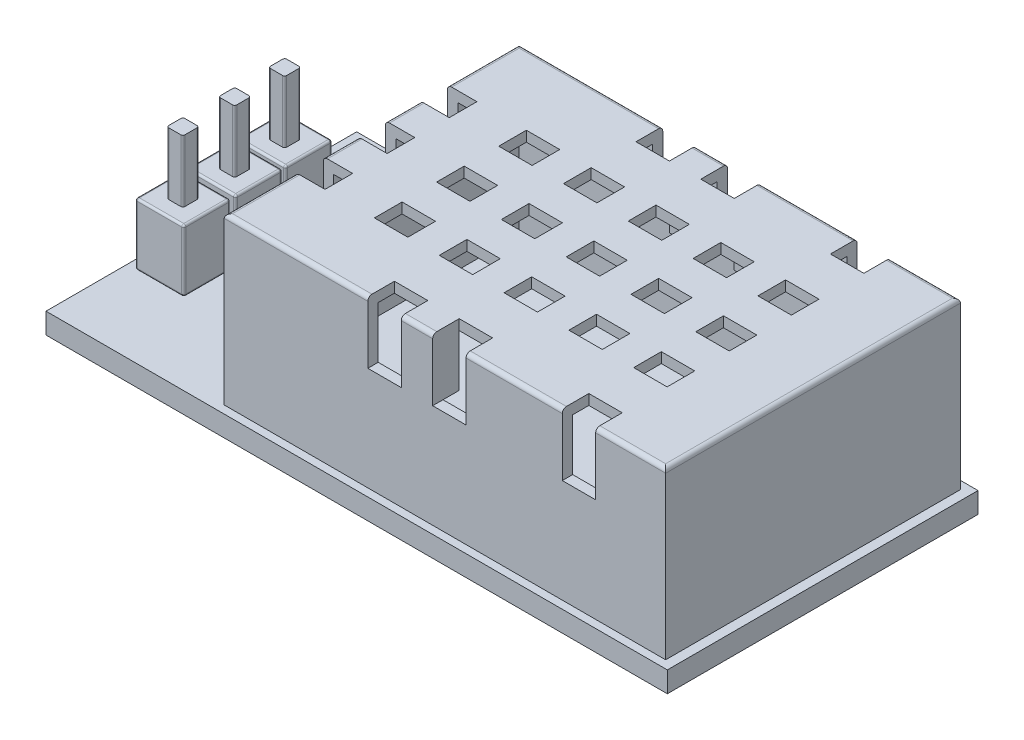
from build123d import *

# Parameters (mm, degrees)
SKETCH_1_W              = 30
SKETCH_1_H              = 15
EXTRUDE_1_DEPTH         = 0.5
SKETCH_2_W              = 21.312258838
SKETCH_2_H              = 14.23879362
EXTRUDE_2_DEPTH         = 8
SKETCH_3_W              = 1.613226707
SKETCH_3_H              = 1.334895255
CUT_EXTRUDE_1_DEPTH     = 3
THICKEN_START           = -7.11939681
THICKEN_1_OUTLINE_W     = 1.516062885
THICKEN_1_OUTLINE_H     = 0.5
THICKEN_1_OUTLINE_W_2   = 1.516062886
THICKEN_1_OUTLINE_W_3   = 2.386773293
THICKEN_1_DEPTH         = 14.23879362
THICKEN_1_2_DEPTH       = 0.5
THICKEN_START_2         = 6.61939681
THICKEN_1_3_DEPTH       = 0.5
THICKEN_START_3         = -5.827698579
THICKEN_1_4_OUTLINE_W   = 1.613226707
THICKEN_1_4_OUTLINE_H   = 0.5
THICKEN_1_4_DEPTH       = 2.165104745
THICKEN_START_4         = 3.672301421
THICKEN_1_5_OUTLINE_W   = 1.613226707
THICKEN_1_5_OUTLINE_H   = 0.5
THICKEN_1_5_DEPTH       = 2.165104745
THICKEN_START_5         = -2.327698579
THICKEN_1_6_OUTLINE_W   = 1.613226707
THICKEN_1_6_OUTLINE_H   = 0.5
THICKEN_1_6_DEPTH       = 1.665104745
THICKEN_START_6         = 0.672301421
THICKEN_1_7_OUTLINE_W   = 1.613226707
THICKEN_1_7_OUTLINE_H   = 0.5
THICKEN_1_7_DEPTH       = 1.665104745
THICKEN_START_7         = -6.61939681
THICKEN_1_8_OUTLINE_W   = 0.5
THICKEN_1_8_OUTLINE_H   = 2.5
THICKEN_1_8_OUTLINE_W_2 = 1.613226707
THICKEN_1_8_OUTLINE_H_2 = 0.5
THICKEN_1_8_DEPTH       = 0.791698231
THICKEN_START_8         = 5.837406166
THICKEN_1_9_OUTLINE_W   = 0.5
THICKEN_1_9_OUTLINE_H   = 2.5
THICKEN_1_9_OUTLINE_W_2 = 1.613226707
THICKEN_1_9_OUTLINE_H_2 = 0.5
THICKEN_1_9_DEPTH       = 0.781990644
FILLET_1_R              = 0.2
SKETCH_4_W              = 2.342511209
SKETCH_4_H              = 2.250648024
EXTRUDE_3_DEPTH         = 3
EXTRUDE_3_2_DEPTH       = 3
SKETCH_4_H_2            = 2.250648023
EXTRUDE_3_3_DEPTH       = 3
SKETCH_5_W              = 0.780837069
SKETCH_5_H              = 0.78083707
EXTRUDE_4_DEPTH         = 3
SKETCH_5_H_2            = 0.780837069
EXTRUDE_4_2_DEPTH       = 3
EXTRUDE_4_3_DEPTH       = 3
FILLET_2_R              = 0.1
FILLET_3_R              = 0.1
FILLET_4_R              = 0.1
FILLET_6_R              = 0.1
FILLET_7_R              = 0.1
FILLET_8_R              = 0.1
SKETCH_6_R              = 1.271442561
CUT_EXTRUDE_2_DEPTH     = 19.580904176


# Read off the part's stored shape, not the designer's step: 두껍게1
with BuildPart() as part:
    # 스케치1 → 보스-돌출1 (new, symmetric)
    with BuildSketch(Plane(origin=(0, 0, 0), x_dir=(1, 0, 0), z_dir=(0, 1, 0))):
        Rectangle(SKETCH_1_W, SKETCH_1_H)
    extrude(amount=EXTRUDE_1_DEPTH, both=True)

    # 두껍게1 outline → 두껍게1 (add)
    with BuildSketch(Plane.XY.offset(THICKEN_START)):
        Polygon((11.160459425, 8.5), (11.160459425, 8), (14.03734897, 8), (14.03734897, 1), (-6.274909868, 1), (-6.274909868, 5.5), (-6.774909868, 5.5), (-6.774909868, 0.5), (14.53734897, 0.5), (14.53734897, 8.5), align=None)
        with Locations((8.789201275, 8.25)):
            Rectangle(THICKEN_1_OUTLINE_W, THICKEN_1_OUTLINE_H)
        with Locations((5.659911683, 8.25)):
            Rectangle(THICKEN_1_OUTLINE_W_2, THICKEN_1_OUTLINE_H)
        with Locations((2.530622091, 8.25)):
            Rectangle(THICKEN_1_OUTLINE_W, THICKEN_1_OUTLINE_H)
        with Locations((-4.163312298, 8.25)):
            Rectangle(THICKEN_1_OUTLINE_W_3, THICKEN_1_OUTLINE_H)
        with Locations((-0.598667502, 8.25)):
            Rectangle(THICKEN_1_OUTLINE_W, THICKEN_1_OUTLINE_H)
    extrude(amount=THICKEN_1_DEPTH)

    # Thicken 1 2 outline → Thicken 1 2 (add)
    with BuildSketch(Plane.XY.offset(THICKEN_START)):
        Polygon((11.160459425, 8), (11.160459425, 5.5), (9.547232718, 5.5), (9.547232718, 8), (8.031169833, 8), (8.031169833, 8.5), (6.417943126, 8.5), (6.417943126, 8), (4.90188024, 8), (4.90188024, 5.5), (3.288653533, 5.5), (3.288653533, 8), (1.772590648, 8), (1.772590648, 5.5), (0.159363941, 5.5), (0.159363941, 8), (-1.356698944, 8), (-1.356698944, 8.5), (-2.969925651, 8.5), (-2.969925651, 8), (-5.356698944, 8), (-5.356698944, 8.5), (-6.774909868, 8.5), (-6.774909868, 5.5), (-6.274909868, 5.5), (-6.274909868, 1), (14.03734897, 1), (14.03734897, 8), align=None)
    extrude(amount=THICKEN_1_2_DEPTH)

    # Thicken 1 3 outline → Thicken 1 3 (add)
    with BuildSketch(Plane.XY.offset(THICKEN_START_2)):
        Polygon((11.160459425, 8), (11.160459425, 5.5), (9.547232718, 5.5), (9.547232718, 8), (8.031169833, 8), (8.031169833, 8.5), (6.417943126, 8.5), (6.417943126, 8), (4.90188024, 8), (4.90188024, 5.5), (3.288653533, 5.5), (3.288653533, 8), (1.772590648, 8), (1.772590648, 5.5), (0.159363941, 5.5), (0.159363941, 8), (-1.356698944, 8), (-1.356698944, 8.5), (-2.969925651, 8.5), (-2.969925651, 8), (-5.356698944, 8), (-5.356698944, 8.5), (-6.774909868, 8.5), (-6.774909868, 5.5), (-6.274909868, 5.5), (-6.274909868, 1), (14.03734897, 1), (14.03734897, 8), align=None)
    extrude(amount=THICKEN_1_3_DEPTH)

    # Thicken 1 4 outline → Thicken 1 4 (add)
    with BuildSketch(Plane.XY.offset(THICKEN_START_3)):
        with Locations((10.353846072, 8.25)):
            Rectangle(THICKEN_1_4_OUTLINE_W, THICKEN_1_4_OUTLINE_H)
        with Locations((7.22455648, 8.25)):
            Rectangle(THICKEN_1_4_OUTLINE_W, THICKEN_1_4_OUTLINE_H)
        Polygon((-6.774909868, 5.5), (-6.274909868, 5.5), (-6.274909868, 8), (-5.356698944, 8), (-5.356698944, 8.5), (-6.774909868, 8.5), align=None)
        with Locations((4.095266887, 8.25)):
            Rectangle(THICKEN_1_4_OUTLINE_W, THICKEN_1_4_OUTLINE_H)
        with Locations((0.965977295, 8.25)):
            Rectangle(THICKEN_1_4_OUTLINE_W, THICKEN_1_4_OUTLINE_H)
        with Locations((-2.163312298, 8.25)):
            Rectangle(THICKEN_1_4_OUTLINE_W, THICKEN_1_4_OUTLINE_H)
    extrude(amount=THICKEN_1_4_DEPTH)

    # Thicken 1 5 outline → Thicken 1 5 (add)
    with BuildSketch(Plane.XY.offset(THICKEN_START_4)):
        with Locations((10.353846072, 8.25)):
            Rectangle(THICKEN_1_5_OUTLINE_W, THICKEN_1_5_OUTLINE_H)
        with Locations((7.22455648, 8.25)):
            Rectangle(THICKEN_1_5_OUTLINE_W, THICKEN_1_5_OUTLINE_H)
        Polygon((-6.774909868, 5.5), (-6.274909868, 5.5), (-6.274909868, 8), (-5.356698944, 8), (-5.356698944, 8.5), (-6.774909868, 8.5), align=None)
        with Locations((4.095266887, 8.25)):
            Rectangle(THICKEN_1_5_OUTLINE_W, THICKEN_1_5_OUTLINE_H)
        with Locations((0.965977295, 8.25)):
            Rectangle(THICKEN_1_5_OUTLINE_W, THICKEN_1_5_OUTLINE_H)
        with Locations((-2.163312298, 8.25)):
            Rectangle(THICKEN_1_5_OUTLINE_W, THICKEN_1_5_OUTLINE_H)
    extrude(amount=THICKEN_1_5_DEPTH)

    # Thicken 1 6 outline → Thicken 1 6 (add)
    with BuildSketch(Plane.XY.offset(THICKEN_START_5)):
        with Locations((10.353846072, 8.25)):
            Rectangle(THICKEN_1_6_OUTLINE_W, THICKEN_1_6_OUTLINE_H)
        with Locations((7.22455648, 8.25)):
            Rectangle(THICKEN_1_6_OUTLINE_W, THICKEN_1_6_OUTLINE_H)
        Polygon((-6.774909868, 5.5), (-6.274909868, 5.5), (-6.274909868, 8), (-5.356698944, 8), (-5.356698944, 8.5), (-6.774909868, 8.5), align=None)
        with Locations((4.095266887, 8.25)):
            Rectangle(THICKEN_1_6_OUTLINE_W, THICKEN_1_6_OUTLINE_H)
        with Locations((0.965977295, 8.25)):
            Rectangle(THICKEN_1_6_OUTLINE_W, THICKEN_1_6_OUTLINE_H)
        with Locations((-2.163312298, 8.25)):
            Rectangle(THICKEN_1_6_OUTLINE_W, THICKEN_1_6_OUTLINE_H)
    extrude(amount=THICKEN_1_6_DEPTH)

    # Thicken 1 7 outline → Thicken 1 7 (add)
    with BuildSketch(Plane.XY.offset(THICKEN_START_6)):
        with Locations((10.353846072, 8.25)):
            Rectangle(THICKEN_1_7_OUTLINE_W, THICKEN_1_7_OUTLINE_H)
        with Locations((7.22455648, 8.25)):
            Rectangle(THICKEN_1_7_OUTLINE_W, THICKEN_1_7_OUTLINE_H)
        Polygon((-6.774909868, 5.5), (-6.274909868, 5.5), (-6.274909868, 8), (-5.356698944, 8), (-5.356698944, 8.5), (-6.774909868, 8.5), align=None)
        with Locations((4.095266887, 8.25)):
            Rectangle(THICKEN_1_7_OUTLINE_W, THICKEN_1_7_OUTLINE_H)
        with Locations((0.965977295, 8.25)):
            Rectangle(THICKEN_1_7_OUTLINE_W, THICKEN_1_7_OUTLINE_H)
        with Locations((-2.163312298, 8.25)):
            Rectangle(THICKEN_1_7_OUTLINE_W, THICKEN_1_7_OUTLINE_H)
    extrude(amount=THICKEN_1_7_DEPTH)

    # Thicken 1 8 outline → Thicken 1 8 (add)
    with BuildSketch(Plane.XY.offset(THICKEN_START_7)):
        with Locations((11.410459425, 6.75)):
            Rectangle(THICKEN_1_8_OUTLINE_W, THICKEN_1_8_OUTLINE_H)
        with Locations((7.22455648, 8.25)):
            Rectangle(THICKEN_1_8_OUTLINE_W_2, THICKEN_1_8_OUTLINE_H_2)
        with Locations((5.15188024, 6.75)):
            Rectangle(THICKEN_1_8_OUTLINE_W, THICKEN_1_8_OUTLINE_H)
        Polygon((-6.774909868, 5.5), (-6.274909868, 5.5), (-6.274909868, 8), (-5.356698944, 8), (-5.356698944, 8.5), (-6.774909868, 8.5), align=None)
        with Locations((-2.163312298, 8.25)):
            Rectangle(THICKEN_1_8_OUTLINE_W_2, THICKEN_1_8_OUTLINE_H_2)
        with Locations((2.022590648, 6.75)):
            Rectangle(THICKEN_1_8_OUTLINE_W, THICKEN_1_8_OUTLINE_H)
    extrude(amount=THICKEN_1_8_DEPTH)

    # Thicken 1 9 outline → Thicken 1 9 (add)
    with BuildSketch(Plane.XY.offset(THICKEN_START_8)):
        with Locations((11.410459425, 6.75)):
            Rectangle(THICKEN_1_9_OUTLINE_W, THICKEN_1_9_OUTLINE_H)
        with Locations((7.22455648, 8.25)):
            Rectangle(THICKEN_1_9_OUTLINE_W_2, THICKEN_1_9_OUTLINE_H_2)
        Polygon((-6.774909868, 5.5), (-6.274909868, 5.5), (-6.274909868, 8), (-5.356698944, 8), (-5.356698944, 8.5), (-6.774909868, 8.5), align=None)
        with Locations((3.038653533, 6.75)):
            Rectangle(THICKEN_1_9_OUTLINE_W, THICKEN_1_9_OUTLINE_H)
        with Locations((-2.163312298, 8.25)):
            Rectangle(THICKEN_1_9_OUTLINE_W_2, THICKEN_1_9_OUTLINE_H_2)
    extrude(amount=THICKEN_1_9_DEPTH)

    # 필렛1
    fillet_1_edges = [part.edges().sort_by_distance(p)[0] for p in [
        (2.530622091, 8.5, -7.11939681),
        (-3.307772964, 8.5, -7.11939681),
        (-6.774909868, 8.5, -5.390995322),
        (-6.774909868, 8.5, -1.495146207),
        (-6.774909868, 8.5, 1.504853794),
        (-6.774909868, 8.5, 5.395849115),
        (-3.307772963, 8.5, 7.11939681),
        (2.530622091, 8.5, 7.11939681),
        (7.224556479, 8.5, 7.11939681),
        (12.848904198, 8.5, 7.11939681),
        (14.53734897, 8.5, 0),
        (12.848904198, 8.5, -7.11939681),
        (7.224556479, 8.5, -7.11939681),
    ]]
    fillet(fillet_1_edges, radius=FILLET_1_R)

    # 스케치6 → 컷-돌출2 (cut, through all)
    with BuildSketch(Plane(origin=(0, 0.5, 0), x_dir=(1, 0, 0), z_dir=(0, 1, 0))):
        with Locations(Location((-8.244720822, 0, 0), (0, 0, 270))):
            Circle(SKETCH_6_R)
    extrude(amount=-CUT_EXTRUDE_2_DEPTH, mode=Mode.SUBTRACT)


with BuildPart() as body_2:
    # 스케치2 → 보스-돌출2 (new body)
    with BuildSketch(Plane(origin=(0, 0.5, 0), x_dir=(1, 0, 0), z_dir=(0, 1, 0))):
        with Locations((3.881219551, 0)):
            Rectangle(SKETCH_2_W, SKETCH_2_H)
    extrude(amount=EXTRUDE_2_DEPTH)

    # 스케치3 → 컷-돌출1 (cut)
    with BuildSketch(Plane(origin=(0, 8.5, 0), x_dir=(1, 0, 0), z_dir=(0, 1, 0))):
        with Locations((0.965977295, -3.004853794)):
            Rectangle(SKETCH_3_W, SKETCH_3_H)
        with Locations((-2.163312298, -3.004853794)):
            Rectangle(SKETCH_3_W, SKETCH_3_H)
        with Locations((4.095266887, -3.004853794)):
            Rectangle(SKETCH_3_W, SKETCH_3_H)
        with Locations((7.22455648, -3.004853794)):
            Rectangle(SKETCH_3_W, SKETCH_3_H)
        with Locations((10.353846072, -3.004853794)):
            Rectangle(SKETCH_3_W, SKETCH_3_H)
        with Locations((0.965977295, -0.004853793)):
            Rectangle(SKETCH_3_W, SKETCH_3_H)
        with Locations((-2.163312298, -0.004853793)):
            Rectangle(SKETCH_3_W, SKETCH_3_H)
        with Locations((4.095266887, -0.004853793)):
            Rectangle(SKETCH_3_W, SKETCH_3_H)
        with Locations((7.22455648, -0.004853793)):
            Rectangle(SKETCH_3_W, SKETCH_3_H)
        with Locations((10.353846072, -0.004853793)):
            Rectangle(SKETCH_3_W, SKETCH_3_H)
        with Locations((0.965977295, 2.995146207)):
            Rectangle(SKETCH_3_W, SKETCH_3_H)
        with Locations((-2.163312298, 2.995146207)):
            Rectangle(SKETCH_3_W, SKETCH_3_H)
        with Locations((4.095266887, 2.995146207)):
            Rectangle(SKETCH_3_W, SKETCH_3_H)
        with Locations((7.22455648, 2.995146207)):
            Rectangle(SKETCH_3_W, SKETCH_3_H)
        with Locations((10.353846072, 2.995146207)):
            Rectangle(SKETCH_3_W, SKETCH_3_H)
        with Locations((0.965977295, 6.495146207)):
            Rectangle(SKETCH_3_W, SKETCH_3_H)
        with Locations((4.095266887, 6.495146207)):
            Rectangle(SKETCH_3_W, SKETCH_3_H)
        with Locations((0.965977295, -6.504853794)):
            Rectangle(SKETCH_3_W, SKETCH_3_H)
        with Locations((4.095266887, -6.504853794)):
            Rectangle(SKETCH_3_W, SKETCH_3_H)
        with Locations((-6.163312298, -3.004853794)):
            Rectangle(SKETCH_3_W, SKETCH_3_H)
        with Locations((-6.163312298, -0.004853793)):
            Rectangle(SKETCH_3_W, SKETCH_3_H)
        with Locations((-6.163312298, 2.995146207)):
            Rectangle(SKETCH_3_W, SKETCH_3_H)
        with Locations((10.353846072, 6.495146207)):
            Rectangle(SKETCH_3_W, SKETCH_3_H)
        with Locations((10.353846072, -6.504853794)):
            Rectangle(SKETCH_3_W, SKETCH_3_H)
    extrude(amount=-CUT_EXTRUDE_1_DEPTH, mode=Mode.SUBTRACT)

    # Delete Face 1: 19 faces struck out; the rest of the skin is kept as a surface, the solid goes
    delete_face_1_1_drop = [body_2.part.faces().sort_by_distance(Vector(p))[0] for p in ((9.547232718, 7, 6.478401488), (10.353846072, 7, 5.837406166), (10.353846072, 5.5, 6.478401488), (4.095266887, 7, 5.837406166), (4.90188024, 7, 6.478401488), (4.095266887, 5.5, 6.478401488), (0.965977294, 5.5, 6.478401488), (1.772590648, 7, 6.478401488), (0.965977294, 7, 5.837406166), (0.159363941, 7, 6.478401488), (4.095266887, 7, -5.827698579), (3.288653533, 7, -6.473547694), (0.965977294, 7, -5.827698579), (0.159363941, 7, -6.473547694), (0.965977294, 5.5, -6.473547694), (4.095266887, 5.5, -6.473547694), (10.353846072, 7, -5.827698579), (9.547232718, 7, -6.473547694), (10.353846072, 5.5, -6.473547694))]
    delete_face_1_1 = Shell(body_2.part.faces() - delete_face_1_1_drop)


with BuildPart() as body_2_2:
    # 스케치4 → 보스-돌출3 (new body)
    with BuildSketch(Plane(origin=(0, 0.5, 0), x_dir=(1, 0, 0), z_dir=(0, 1, 0))):
        with Locations((-13.412024959, 0.022965796)):
            Rectangle(SKETCH_4_W, SKETCH_4_H)
    extrude(amount=EXTRUDE_3_DEPTH)

    # 필렛6
    fillet_6_edges = [body_2_2.edges().sort_by_distance(p)[0] for p in [
        (-14.583280563, 3.5, -0.022965796),
        (-13.412024958, 3.5, 1.102358216),
        (-12.240769354, 3.5, -0.022965796),
        (-13.412024958, 0.5, 1.102358216),
        (-14.583280563, 0.5, -0.022965796),
        (-13.412024958, 0.5, -1.148289808),
        (-12.240769354, 0.5, -0.022965796),
        (-12.240769354, 2, 1.102358216),
        (-14.583280563, 2, 1.102358216),
        (-14.583280563, 2, -1.148289808),
        (-12.240769354, 2, -1.148289808),
        (-13.412024958, 3.5, -1.148289808),
    ]]
    fillet(fillet_6_edges, radius=FILLET_6_R)


with BuildPart() as body_3:
    # 스케치4 → Extrude 3 2 (new body)
    with BuildSketch(Plane(origin=(0, 0.5, 0), x_dir=(1, 0, 0), z_dir=(0, 1, 0))):
        with Locations((-13.434990755, 2.457340189)):
            Rectangle(SKETCH_4_W, SKETCH_4_H)
    extrude(amount=EXTRUDE_3_2_DEPTH)

    # 필렛7
    fillet_7_edges = [body_3.edges().sort_by_distance(p)[0] for p in [
        (-14.606246359, 3.5, -2.457340189),
        (-13.434990755, 3.5, -1.332016177),
        (-12.26373515, 3.5, -2.457340189),
        (-13.434990755, 0.5, -1.332016177),
        (-14.606246359, 0.5, -2.457340189),
        (-13.434990755, 0.5, -3.582664201),
        (-12.26373515, 0.5, -2.457340189),
        (-12.26373515, 2, -1.332016177),
        (-14.606246359, 2, -1.332016177),
        (-14.606246359, 2, -3.582664201),
        (-12.26373515, 2, -3.582664201),
        (-13.434990755, 3.5, -3.582664201),
    ]]
    fillet(fillet_7_edges, radius=FILLET_7_R)


with BuildPart() as body_4:
    # 스케치4 → Extrude 3 3 (new body)
    with BuildSketch(Plane(origin=(0, 0.5, 0), x_dir=(1, 0, 0), z_dir=(0, 1, 0))):
        with Locations((-13.412024959, -2.480305986)):
            Rectangle(SKETCH_4_W, SKETCH_4_H_2)
    extrude(amount=EXTRUDE_3_3_DEPTH)

    # 필렛8
    fillet_8_edges = [body_4.edges().sort_by_distance(p)[0] for p in [
        (-14.583280563, 3.5, 2.480305985),
        (-13.412024958, 3.5, 3.605629997),
        (-12.240769354, 3.5, 2.480305985),
        (-13.412024958, 0.5, 3.605629997),
        (-14.583280563, 0.5, 2.480305985),
        (-13.412024958, 0.5, 1.354981974),
        (-12.240769354, 0.5, 2.480305985),
        (-12.240769354, 2, 3.605629997),
        (-14.583280563, 2, 3.605629997),
        (-14.583280563, 2, 1.354981974),
        (-12.240769354, 2, 1.354981974),
        (-13.412024958, 3.5, 1.354981974),
    ]]
    fillet(fillet_8_edges, radius=FILLET_8_R)


with BuildPart() as body_5:
    # 스케치5 → 보스-돌출4 (new body)
    with BuildSketch(Plane(origin=(0, 3.5, 0), x_dir=(1, 0, 0), z_dir=(0, 1, 0))):
        with Locations((-13.412024959, 0.022965796)):
            Rectangle(SKETCH_5_W, SKETCH_5_H)
    extrude(amount=EXTRUDE_4_DEPTH)

    # 필렛2
    fillet_2_edges = [body_5.edges().sort_by_distance(p)[0] for p in [
        (-13.021606424, 5, 0.367452739),
        (-13.802443493, 5, 0.367452739),
        (-13.802443493, 5, -0.413384331),
        (-13.021606424, 5, -0.413384331),
    ]]
    fillet(fillet_2_edges, radius=FILLET_2_R)


with BuildPart() as body_6:
    # 스케치5 → Extrude 4 2 (new body)
    with BuildSketch(Plane(origin=(0, 3.5, 0), x_dir=(1, 0, 0), z_dir=(0, 1, 0))):
        with Locations((-13.434990755, 2.457340189)):
            Rectangle(SKETCH_5_W, SKETCH_5_H_2)
    extrude(amount=EXTRUDE_4_2_DEPTH)

    # 필렛3
    fillet_3_edges = [body_6.edges().sort_by_distance(p)[0] for p in [
        (-13.04457222, 5, -2.066921655),
        (-13.825409289, 5, -2.066921655),
        (-13.825409289, 5, -2.847758724),
        (-13.04457222, 5, -2.847758724),
    ]]
    fillet(fillet_3_edges, radius=FILLET_3_R)


with BuildPart() as body_7:
    # 스케치5 → Extrude 4 3 (new body)
    with BuildSketch(Plane(origin=(0, 3.5, 0), x_dir=(1, 0, 0), z_dir=(0, 1, 0))):
        with Locations((-13.412024959, -2.480305986)):
            Rectangle(SKETCH_5_W, SKETCH_5_H_2)
    extrude(amount=EXTRUDE_4_3_DEPTH)

    # 필렛4
    fillet_4_edges = [body_7.edges().sort_by_distance(p)[0] for p in [
        (-13.021606424, 5, 2.87072452),
        (-13.802443493, 5, 2.87072452),
        (-13.802443493, 5, 2.089887451),
        (-13.021606424, 5, 2.089887451),
    ]]
    fillet(fillet_4_edges, radius=FILLET_4_R)


solid = Compound([part.part, body_2_2.part, body_3.part, body_4.part, body_5.part, body_6.part, body_7.part])
